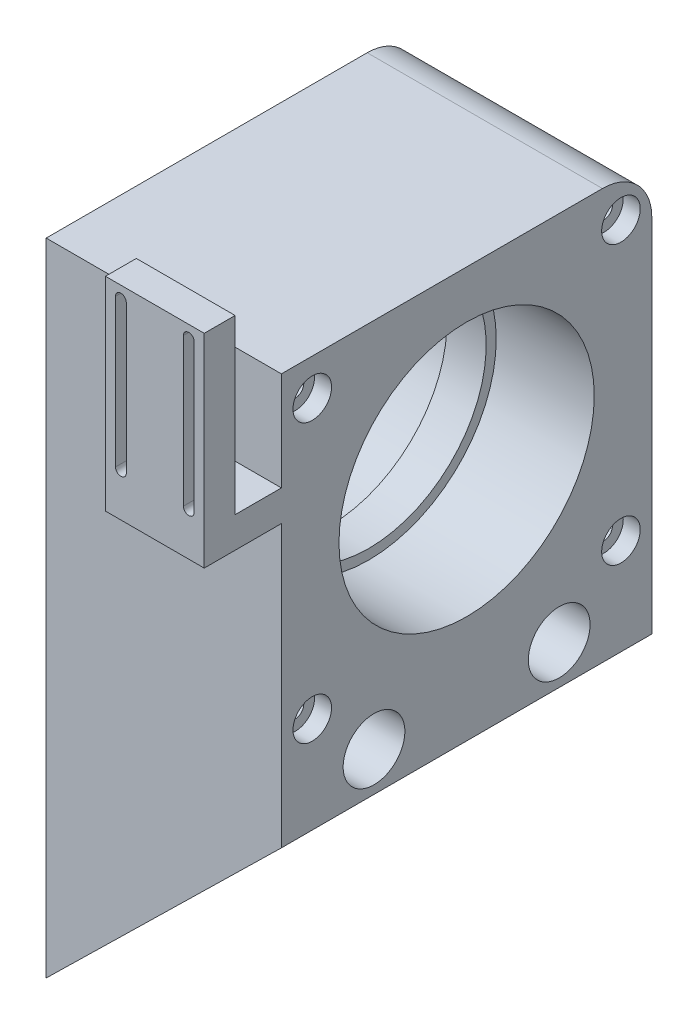
from build123d import *

# Parameters (mm, degrees)
BOSS_EXTRUDE1_DEPTH = 120
SKETCH3_R           = 4.25
CUT_EXTRUDE1_DEPTH  = 120
SKETCH5_R           = 10
CUT_EXTRUDE2_DEPTH  = 53
SKETCH6_R           = 4.25
CUT_EXTRUDE3_DEPTH  = 103
SKETCH7_W           = 76.2
SKETCH7_H           = 120
BOSS_EXTRUDE2_DEPTH = 101.6
SKETCH8_R           = 41.35
CUT_EXTRUDE4_DEPTH  = 31.75
CUT_EXTRUDE5_START  = -31.75
SKETCH9_R           = 41.35
CUT_EXTRUDE5_DEPTH  = 31.75
SKETCH10_R          = 38.1
CUT_EXTRUDE6_DEPTH  = 76.2
SKETCH13_W          = 76.2
SKETCH13_H          = 120
BOSS_EXTRUDE3_DEPTH = 6
SKETCH11_R          = 2.75
CUT_EXTRUDE7_DEPTH  = 84.4
SKETCH12_R          = 6.25
CUT_EXTRUDE8_DEPTH  = 5.5
FILLET1_R           = 16
SKETCH18_W          = 32
SKETCH18_H          = 10
BOSS_EXTRUDE6_DEPTH = 15
SKETCH20_W          = 32
SKETCH20_H          = 65.882542047
BOSS_EXTRUDE7_DEPTH = 10


with BuildPart() as part:
    # Sketch1 → Boss-Extrude1 (new body)
    with BuildSketch(Plane.XY):
        Polygon((381, 457.2), (457.2, 457.2), (457.2, 431.8), (381, 357.2), align=None)
    extrude(amount=BOSS_EXTRUDE1_DEPTH)

    # Sketch3 → Cut-Extrude1 (cut)
    with BuildSketch(Plane(origin=(457.2, 0, 0), x_dir=(0, 0, -1), z_dir=(1, 0, 0))):
        with Locations((-90, 394.5)):
            Circle(SKETCH3_R)
        with Locations((-30, 394.5)):
            Circle(SKETCH3_R)
    extrude(amount=-CUT_EXTRUDE1_DEPTH, mode=Mode.SUBTRACT)

    # Sketch5 → Cut-Extrude2 (cut)
    with BuildSketch(Plane(origin=(457.2, 0, 0), x_dir=(0, 0, -1), z_dir=(1, 0, 0))):
        with Locations((-90, 394.5)):
            Circle(SKETCH5_R)
        with Locations((-30, 394.5)):
            Circle(SKETCH5_R)
        with Locations((-90, 444.5)):
            Circle(SKETCH5_R)
        with Locations((-30, 444.5)):
            Circle(SKETCH5_R)
    extrude(amount=-CUT_EXTRUDE2_DEPTH, mode=Mode.SUBTRACT)

    # Sketch6 → Cut-Extrude3 (cut)
    with BuildSketch(Plane(origin=(457.2, 0, 0), x_dir=(0, 0, -1), z_dir=(1, 0, 0))):
        with Locations((-90, 444.5)):
            Circle(SKETCH6_R)
        with Locations((-30, 444.5)):
            Circle(SKETCH6_R)
    extrude(amount=-CUT_EXTRUDE3_DEPTH, mode=Mode.SUBTRACT)

    # Sketch7 → Boss-Extrude2 (add)
    with BuildSketch(Plane(origin=(0, 457.2, 0), x_dir=(1, 0, 0), z_dir=(0, 1, 0))):
        with Locations((419.1, -60)):
            Rectangle(SKETCH7_W, SKETCH7_H)
    extrude(amount=BOSS_EXTRUDE2_DEPTH)

    # Sketch8 → Cut-Extrude4 (cut)
    with BuildSketch(Plane.ZY.offset(-381)):
        with Locations((60, 508)):
            Circle(SKETCH8_R)
    extrude(amount=-CUT_EXTRUDE4_DEPTH, mode=Mode.SUBTRACT)

    # Sketch9 → Cut-Extrude5 (cut)
    with BuildSketch(Plane(origin=(457.2, 0, 0), x_dir=(0, 0, -1), z_dir=(1, 0, 0)).offset(CUT_EXTRUDE5_START)):
        with Locations((-60, 508)):
            Circle(SKETCH9_R)
    extrude(amount=CUT_EXTRUDE5_DEPTH, mode=Mode.SUBTRACT)

    # Sketch10 → Cut-Extrude6 (cut)
    with BuildSketch(Plane(origin=(457.2, 0, 0), x_dir=(0, 0, -1), z_dir=(1, 0, 0))):
        with Locations((-60, 508)):
            Circle(SKETCH10_R)
    extrude(amount=-CUT_EXTRUDE6_DEPTH, mode=Mode.SUBTRACT)

    # Sketch13 → Boss-Extrude3 (add)
    with BuildSketch(Plane(origin=(0, 558.8, 0), x_dir=(1, 0, 0), z_dir=(0, 1, 0))):
        with Locations((419.1, -60)):
            Rectangle(SKETCH13_W, SKETCH13_H)
    extrude(amount=BOSS_EXTRUDE3_DEPTH)

    # Sketch11 → Cut-Extrude7 (cut)
    with BuildSketch(Plane(origin=(457.2, 0, 0), x_dir=(0, 0, -1), z_dir=(1, 0, 0))):
        with Locations((-110, 553)):
            Circle(SKETCH11_R)
        with Locations((-10, 553)):
            Circle(SKETCH11_R)
        with Locations((-110, 463)):
            Circle(SKETCH11_R)
        with Locations((-10, 463)):
            Circle(SKETCH11_R)
    extrude(amount=-CUT_EXTRUDE7_DEPTH, mode=Mode.SUBTRACT)

    # Sketch12 → Cut-Extrude8 (cut)
    with BuildSketch(Plane(origin=(457.2, 0, 0), x_dir=(0, 0, -1), z_dir=(1, 0, 0))):
        with Locations((-110, 553)):
            Circle(SKETCH12_R)
        with Locations((-10, 553)):
            Circle(SKETCH12_R)
        with Locations((-10, 463)):
            Circle(SKETCH12_R)
        with Locations((-110, 463)):
            Circle(SKETCH12_R)
    extrude(amount=-CUT_EXTRUDE8_DEPTH, mode=Mode.SUBTRACT)

    # Fillet1
    fillet1_edges = [part.edges().sort_by_distance(p)[0] for p in [
        (419.1, 564.8, 0),
    ]]
    fillet(fillet1_edges, radius=FILLET1_R)

    # Sketch18 → Boss-Extrude6 (add)
    with BuildSketch(Plane.XY.offset(120)):
        with Locations((441.2, 527.8)):
            Rectangle(SKETCH18_W, SKETCH18_H)
    extrude(amount=BOSS_EXTRUDE6_DEPTH)

    # Sketch20 → Boss-Extrude7 (add)
    with BuildSketch(Plane.XY.offset(135)):
        with Locations((441.2, 555.741271024)):
            Rectangle(SKETCH20_W, SKETCH20_H)
        with BuildLine():
            ThreePointArc((450.45, 584.682542047), (452.2, 586.432542047), (453.95, 584.682542047))
            Line((453.95, 584.682542047), (453.95, 536.8))
            ThreePointArc((453.95, 536.8), (452.2, 535.05), (450.45, 536.8))
            Line((450.45, 536.8), (450.45, 584.682542047))
        make_face(mode=Mode.SUBTRACT)
        with BuildLine():
            ThreePointArc((428.45, 584.682542047), (430.2, 586.432542047), (431.95, 584.682542047))
            Line((431.95, 584.682542047), (431.95, 536.8))
            ThreePointArc((431.95, 536.8), (430.2, 535.05), (428.45, 536.8))
            Line((428.45, 536.8), (428.45, 584.682542047))
        make_face(mode=Mode.SUBTRACT)
    extrude(amount=BOSS_EXTRUDE7_DEPTH)


solid = part.part
